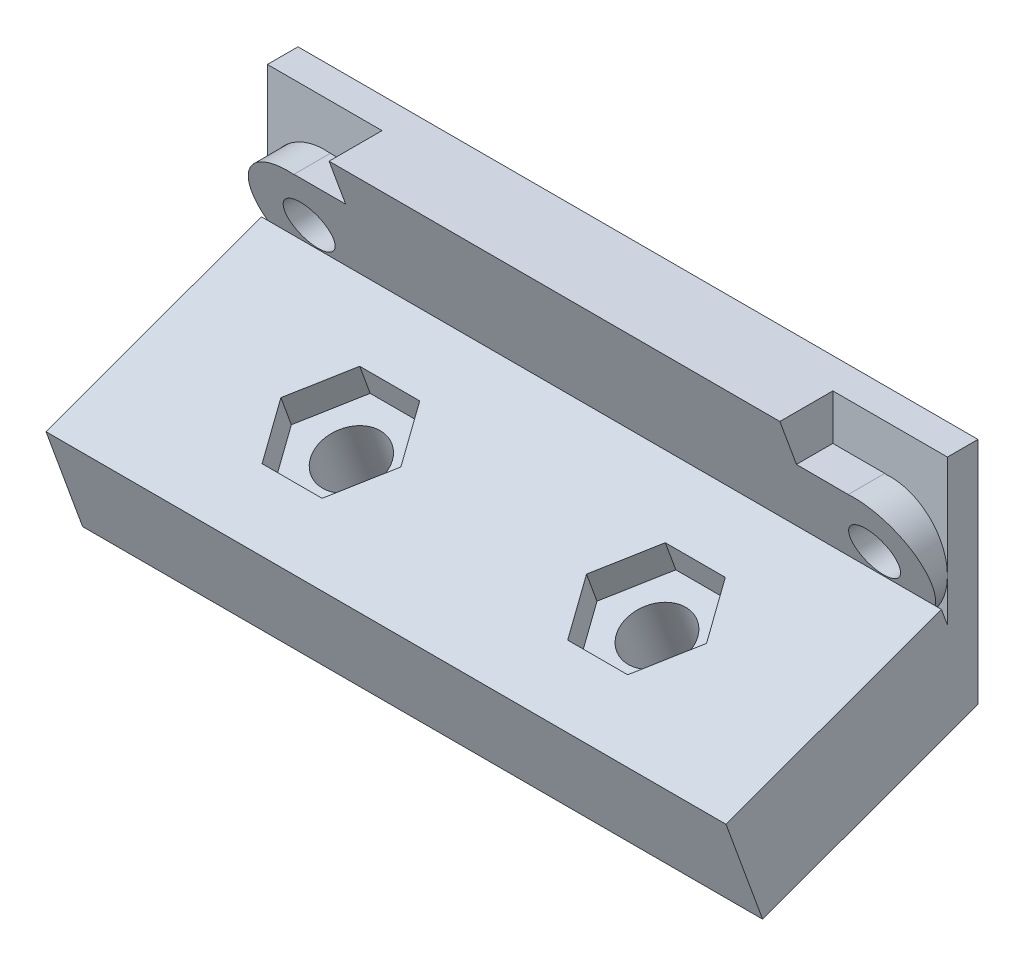
from build123d import *
from build123d.topology import SkipClean

# Parameters (mm, degrees)
SKETCH2_R           = 1.6
SKETCH2_W           = 28.5
SKETCH2_H           = 12
BOSS_EXTRUDE1_DEPTH = 2
SKETCH3_W           = 44.5
SKETCH3_H           = 15
BOSS_EXTRUDE2_DEPTH = 7
BOSS_EXTRUDE3_REACH = 44.543
SKETCH2_3_R         = 1.6
SKETCH2_3_W         = 28.5
SKETCH2_3_H         = 12
SKETCH4_R           = 2.010738951
SKETCH4_R_2         = 2
CUT_EXTRUDE1_DEPTH  = 2
SKETCH4_2_R         = 2
SKETCH4_2_R_2       = 2.010738951
CUT_EXTRUDE2_DEPTH  = 42.581180746
BOSS_EXTRUDE4_DEPTH = 44.5


with BuildPart() as part:
    # Sketch2 → Boss-Extrude1 (new body)
    # profile 1 of 6: a face of its own
    with BuildSketch(Plane.XY):
        with BuildLine():
            ThreePointArc((3.38, 10.004825556), (6.267439172, 9.052511956), (7.5, 6.27312354))
            Line((7.5, 6.27312354), (7.5, 13))
            Line((7.5, 13), (0, 13))
            Line((0, 13), (0, 10.023123532))
            Line((0, 10.023123532), (3.38, 10.023123532))
            Line((3.38, 10.023123532), (3.38, 10.004825556))
        make_face()
    # profile 2 of 6: a face of its own
    with BuildSketch(Plane.XY):
        with BuildLine():
            Line((3.38, 2.523123532), (0, 2.523123532))
            Line((0, 2.523123532), (0, 0))
            Line((0, 0), (7.5, 0))
            Line((7.5, 0), (7.5, 6.27312354))
            ThreePointArc((7.5, 6.27312354), (6.401650432, 3.621473105), (3.75, 2.523123532))
            Line((3.75, 2.523123532), (3.725156678, 2.523123532))
            Line((3.725156678, 2.523123532), (3.38, 2.523123532))
        make_face()
    # profile 3 of 6: a face of its own
    with BuildSketch(Plane.XY):
        with BuildLine():
            Line((-37, 13), (-37, 6.643123532))
            ThreePointArc((-37, 6.643123532), (-35.64002092, 9.18640347), (-32.88, 10.023123532))
            Line((-32.88, 10.023123532), (-29.5, 10.023123532))
            Line((-29.5, 10.023123532), (-29.5, 13))
            Line((-29.5, 13), (-37, 13))
        make_face()
    # profile 4 of 6: a face of its own
    with BuildSketch(Plane.XY):
        with BuildLine():
            Line((-37, 0), (-29.5, 0))
            Line((-29.5, 0), (-29.5, 2.523123532))
            Line((-29.5, 2.523123532), (-32.88, 2.523123532))
            ThreePointArc((-32.88, 2.523123532), (-35.64002092, 3.359843593), (-37, 5.903123532))
            Line((-37, 5.903123532), (-37, 0))
        make_face()
    # profile 5 of 6: a face of its own
    with BuildSketch(Plane.XY):
        with BuildLine():
            Line((3.38, 10.004825556), (0, 10.023123532))
            Line((0, 10.023123532), (0, 13))
            Line((0, 13), (-29.5, 13))
            Line((-29.5, 13), (-29.5, 10.023123532))
            Line((-29.5, 10.023123532), (-32.88, 10.023123532))
            Line((-32.88, 10.023123532), (-32.88, 10.004825556))
            ThreePointArc((-32.88, 10.004825556), (-37, 6.273123532), (-32.88, 2.541421507))
            Line((-32.88, 2.541421507), (-32.88, 2.523123532))
            Line((-32.88, 2.523123532), (-29.5, 2.523123532))
            Line((-29.5, 2.523123532), (-29.5, 0))
            Line((-29.5, 0), (0, 0))
            Line((0, 0), (0, 2.523123532))
            Line((0, 2.523123532), (3.38, 2.523123532))
            Line((3.38, 2.523123532), (3.38, 2.541421507))
            ThreePointArc((3.38, 2.541421507), (7.5, 6.273123532), (3.38, 10.004825556))
        make_face()
        with Locations((3.75, 6.273123532)):
            Circle(SKETCH2_R, mode=Mode.SUBTRACT)
        with Locations((-33.25, 6.273123532)):
            Circle(SKETCH2_R, mode=Mode.SUBTRACT)
        with Locations((-14.75, 6.5)):
            Rectangle(SKETCH2_W, SKETCH2_H, mode=Mode.SUBTRACT)
    # profile 6 of 6: a face of its own
    with BuildSketch(Plane.XY):
        with Locations((-14.75, 6.5)):
            Rectangle(SKETCH2_W, SKETCH2_H)
    extrude(amount=BOSS_EXTRUDE1_DEPTH)

    # Sketch3 → Boss-Extrude2 (add)
    with BuildSketch(Plane(origin=(0, -1.778051923, -0.647157975), x_dir=(1, 0, 0), z_dir=(-1.5523980964466968e-15, 0.9396926207859094, 0.34202014332566594))):
        with Locations((-14.75, -8.188691132)):
            Rectangle(SKETCH3_W, SKETCH3_H)
    extrude(amount=BOSS_EXTRUDE2_DEPTH)

    # Boss-Extrude3: up to this plane
    with SkipClean():  # the faces are left unmerged after this step: merging them gives an invalid solid
        boss_extrude3_end = Plane(origin=(-37, 4.564250183, 2.394141003), z_dir=(0, -0.34202014332566594, 0.9396926207859094))
        # Sketch2<3> → Boss-Extrude3 (add, up to the surface)
        with BuildSketch(Plane.XY, mode=Mode.PRIVATE) as boss_extrude3_sk1:
            with BuildLine():
                Line((3.38, 10.004825556), (0, 10.023123532))
                Line((0, 10.023123532), (0, 13))
                Line((0, 13), (-29.5, 13))
                Line((-29.5, 13), (-29.5, 10.023123532))
                Line((-29.5, 10.023123532), (-32.88, 10.023123532))
                Line((-32.88, 10.023123532), (-32.88, 10.004825556))
                ThreePointArc((-32.88, 10.004825556), (-37, 6.273123532), (-32.88, 2.541421507))
                Line((-32.88, 2.541421507), (-32.88, 2.523123532))
                Line((-32.88, 2.523123532), (-29.5, 2.523123532))
                Line((-29.5, 2.523123532), (-29.5, 0))
                Line((-29.5, 0), (0, 0))
                Line((0, 0), (0, 2.523123532))
                Line((0, 2.523123532), (3.38, 2.523123532))
                Line((3.38, 2.523123532), (3.38, 2.541421507))
                ThreePointArc((3.38, 2.541421507), (7.5, 6.273123532), (3.38, 10.004825556))
            make_face()
            with Locations(Location((3.75, 6.273123532, 0), (0, 0, 270))):
                Circle(SKETCH2_3_R, mode=Mode.SUBTRACT)
            with Locations(Location((-33.25, 6.273123532, 0), (0, 0, 270))):
                Circle(SKETCH2_3_R, mode=Mode.SUBTRACT)
            with Locations((-14.75, 6.5)):
                Rectangle(SKETCH2_3_W, SKETCH2_3_H, mode=Mode.SUBTRACT)
        boss_extrude3_tool1 = split(extrude(boss_extrude3_sk1.sketch, amount=BOSS_EXTRUDE3_REACH, mode=Mode.PRIVATE), bisect_by=boss_extrude3_end, keep=Keep.BOTH, mode=Mode.PRIVATE)
        add(boss_extrude3_tool1.solids().sort_by_distance((1.68749, 9.550381, 0))[0])
        # Sketch2<3> → Boss-Extrude3 (add, up to the surface)
        with BuildSketch(Plane.XY, mode=Mode.PRIVATE) as boss_extrude3_sk2:
            with Locations((-14.75, 6.5)):
                Rectangle(SKETCH2_3_W, SKETCH2_3_H)
        boss_extrude3_tool2 = split(extrude(boss_extrude3_sk2.sketch, amount=BOSS_EXTRUDE3_REACH, mode=Mode.PRIVATE), bisect_by=boss_extrude3_end, keep=Keep.BOTH, mode=Mode.PRIVATE)
        add(boss_extrude3_tool2.solids().sort_by_distance((-14.75, 6.5, 0))[0])

    # Sketch4 → Cut-Extrude1 (cut)
    # profile 1 of 2: a face of its own
    with SkipClean():  # the faces are left unmerged after this step: merging them gives an invalid solid
        with BuildSketch(Plane(origin=(0, 4.799796423, 1.746983028), x_dir=(1, 0, 0), z_dir=(-1.5524032942846936e-15, 0.9396926207859094, 0.34202014332566594))):
            Polygon((-28.67598183, -8.188691132), (-26.712990915, -11.588691132), (-22.787009085, -11.588691132), (-20.82401817, -8.188691132), (-22.787009085, -4.788691132), (-26.712990915, -4.788691132), align=None)
            with Locations(Location((-24.75, -8.188691132, 0), (0, 0, 270))):
                Circle(SKETCH4_R, mode=Mode.SUBTRACT)
        # profile 2 of 2: a face of its own
        with BuildSketch(Plane(origin=(0, 4.799796423, 1.746983028), x_dir=(1, 0, 0), z_dir=(-1.5524032942846936e-15, 0.9396926207859094, 0.34202014332566594))):
            Polygon((-8.67598183, -8.188691132), (-6.712990915, -11.588691132), (-2.787009085, -11.588691132), (-0.82401817, -8.188691132), (-2.787009085, -4.788691132), (-6.712990915, -4.788691132), align=None)
            with Locations(Location((-4.75, -8.188691132, 0), (0, 0, 270))):
                Circle(SKETCH4_R_2, mode=Mode.SUBTRACT)
        extrude(amount=-CUT_EXTRUDE1_DEPTH, mode=Mode.SUBTRACT)

    # Sketch4<2> → Cut-Extrude2 (cut, through all)
    with SkipClean():  # the faces are left unmerged after this step: merging them gives an invalid solid
        with BuildSketch(Plane(origin=(0, 4.799796423, 1.746983028), x_dir=(1, 0, 0), z_dir=(-1.5524032942846936e-15, 0.9396926207859094, 0.34202014332566594))):
            with Locations(Location((-4.75, -8.188691132, 0), (0, 0, 270))):
                Circle(SKETCH4_2_R)
            with Locations(Location((-24.75, -8.188691132, 0), (0, 0, 270))):
                Circle(SKETCH4_2_R_2)
        extrude(amount=-CUT_EXTRUDE2_DEPTH, mode=Mode.SUBTRACT)

    # Sketch5 → Boss-Extrude4 (add)
    with SkipClean():  # the faces are left unmerged after this step: merging them gives an invalid solid
        with BuildSketch(Plane(origin=(7.5, 0, 0), x_dir=(0, 0, -1), z_dir=(1, 0, 0))):
            Polygon((-0.732889795, 0), (0, 0), (0, -2.013598163), align=None)
        extrude(amount=-BOSS_EXTRUDE4_DEPTH)


solid = part.part
